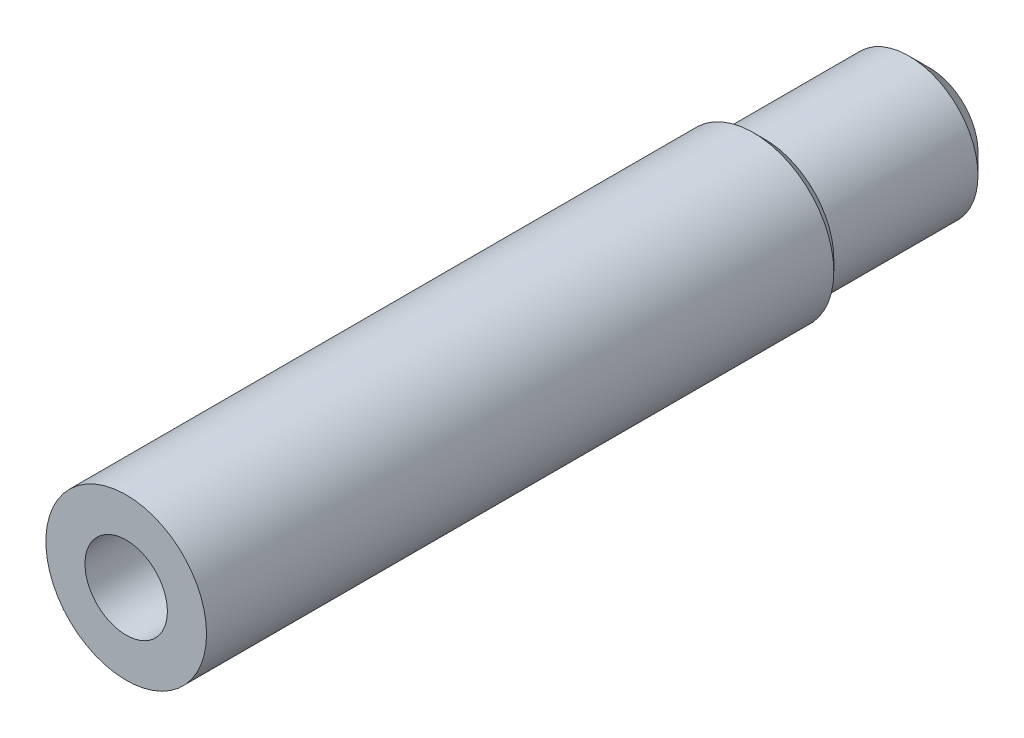
from build123d import *

# Parameters (mm, degrees)
SKETCH1_R               = 3.35
BOSS_EXTRUDE1_DEPTH     = 9
SKETCH2_R               = 3.9
BOSS_EXTRUDE2_DEPTH     = 30
CHAMFER1_SIZE           = 1
CHAMFER2_SIZE           = 1
CUT_EXTRUDE1_DEPTH      = 40.38806926
CUT_EXTRUDE1_DEPTH_BACK = 40.38806926
SKETCH8_R               = 2


with BuildPart() as part:
    # Sketch1 → Boss-Extrude1 (new body)
    with BuildSketch(Plane(origin=(0, 0, 0), x_dir=(0, 1, 0), z_dir=(0, 0, 1))):
        with Locations(Location((0, 0, 0), (0, 0, 270))):
            Circle(SKETCH1_R)
    extrude(amount=BOSS_EXTRUDE1_DEPTH)

    # Sketch2 → Boss-Extrude2 (add)
    with BuildSketch(Plane.XY.offset(9)):
        Circle(SKETCH2_R)
    extrude(amount=BOSS_EXTRUDE2_DEPTH)

    # Chamfer1
    # the kernel refuses this chamfer: 1 mm, written as the material it adds along each edge
    with BuildSketch(Plane(origin=(0, 0, 9), x_dir=(1, 0, 0), z_dir=(0, -1, 0))) as chamfer1_piece_1_section:
        Polygon((3.35 + CHAMFER1_SIZE, 0), (3.35, -CHAMFER1_SIZE), (3.35, 0), align=None)
    chamfer1_piece_1 = revolve(axis=Axis((0, 0, 9), (0, 0, 1)), mode=Mode.PRIVATE)
    chamfer1_piece_1 = chamfer1_piece_1 & Plane(origin=(0, 0, 8.27596247), x_dir=(1, 0, 0), z_dir=(0, 0, -1)) * Cylinder(3.9, 18, mode=Mode.PRIVATE)
    add(chamfer1_piece_1)

    # Chamfer2
    chamfer2_edges = [part.edges().sort_by_distance(p)[0] for p in [
        (-3.35, 0, 0),
    ]]
    chamfer(chamfer2_edges, length=CHAMFER2_SIZE)

    # Sketch8 → Cut-Extrude1 (cut, two sides: drawn at the far end of the back side and taken through both)
    with BuildSketch(Plane.XY.offset(39).offset(-CUT_EXTRUDE1_DEPTH_BACK)):
        Circle(SKETCH8_R)
    extrude(amount=CUT_EXTRUDE1_DEPTH + CUT_EXTRUDE1_DEPTH_BACK, mode=Mode.SUBTRACT)


solid = part.part
